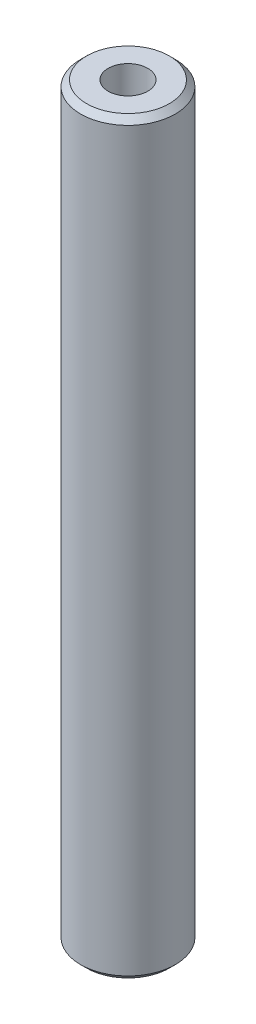
from build123d import *

# Parameters (mm, degrees)
SKETCH1_R           = 15
BOSS_EXTRUDE1_DEPTH = 237.073214667
SKETCH2_R           = 6.283461098
CUT_EXTRUDE1_DEPTH  = 239.020396422
CHAMFER1_SIZE       = 1.899320718


with BuildPart() as part:
    # Sketch1 → Boss-Extrude1 (new body)
    with BuildSketch(Plane(origin=(0, 0, 0), x_dir=(1, 0, 0), z_dir=(0, 1, 0))):
        Circle(SKETCH1_R)
    extrude(amount=BOSS_EXTRUDE1_DEPTH)

    # Sketch2 → Cut-Extrude1 (cut, through all)
    with BuildSketch(Plane(origin=(0, 0, 0), x_dir=(1, 0, 0), z_dir=(0, 1, 0))):
        Circle(SKETCH2_R)
    extrude(amount=CUT_EXTRUDE1_DEPTH, mode=Mode.SUBTRACT)

    # Chamfer1
    chamfer1_edges = [part.edges().sort_by_distance(p)[0] for p in [
        (-15, 237.073214667, 0),
        (-15, 0, 0),
    ]]
    chamfer(chamfer1_edges, length=CHAMFER1_SIZE)


solid = part.part
